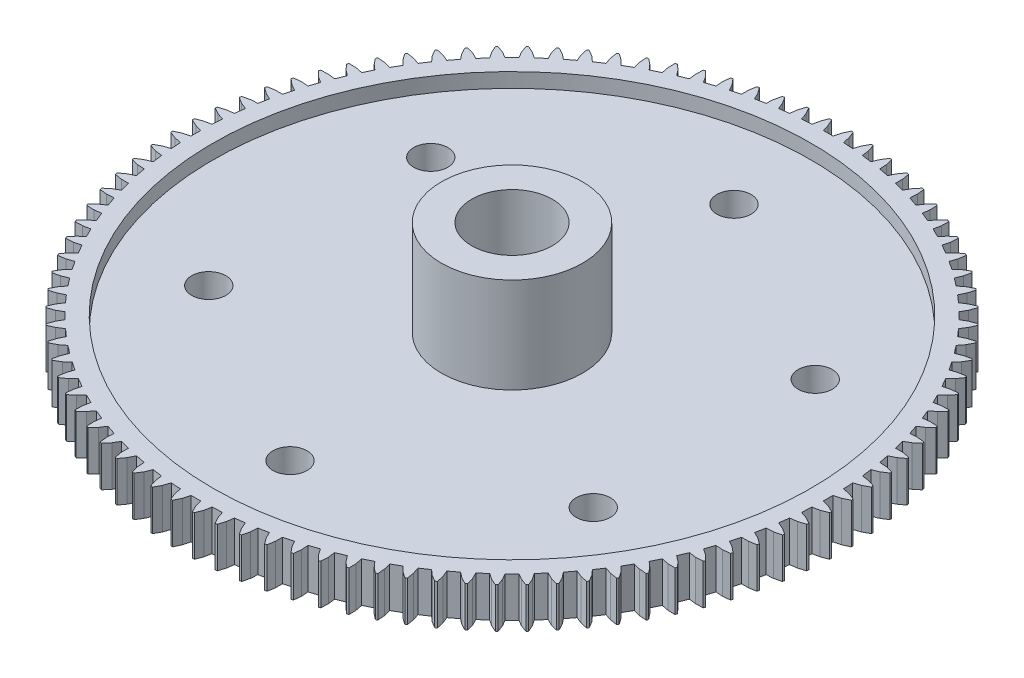
from build123d import *

# Parameters (mm, degrees)
SKETCH1_R           = 25.9334
BOSS_EXTRUDE1_DEPTH = 3.175
SKETCH2_R           = 5.5499
BOSS_EXTRUDE2_DEPTH = 6.35
SKETCH3_R           = 3.175
CUT_EXTRUDE1_DEPTH  = 38.892058484
CUT_EXTRUDE2_START  = -1.143
SKETCH4_R           = 23.5204
SKETCH4_R_2         = 5.5499
CUT_EXTRUDE2_DEPTH  = 1.143
SKETCH5_R           = 1.3462
CUT_EXTRUDE3_DEPTH  = 38.221028614
CIRPATTERN1_COUNT   = 6
CUT_EXTRUDE4_DEPTH  = 38.221028614
CIRPATTERN2_COUNT   = 96


with BuildPart() as part:
    # Sketch1 → Boss-Extrude1 (new body)
    with BuildSketch(Plane(origin=(0, 0, 0), x_dir=(1, 0, 0), z_dir=(0, 1, 0))):
        Circle(SKETCH1_R)
    extrude(amount=BOSS_EXTRUDE1_DEPTH)

    # Sketch2 → Boss-Extrude2 (add)
    with BuildSketch(Plane(origin=(0, 3.175, 0), x_dir=(1, 0, 0), z_dir=(0, 1, 0))):
        Circle(SKETCH2_R)
    extrude(amount=BOSS_EXTRUDE2_DEPTH)

    # Sketch3 → Cut-Extrude1 (cut, through all)
    with BuildSketch(Plane(origin=(0, 9.525, 0), x_dir=(1, 0, 0), z_dir=(0, 1, 0))):
        Circle(SKETCH3_R)
    extrude(amount=-CUT_EXTRUDE1_DEPTH, mode=Mode.SUBTRACT)

    # Sketch4 → Cut-Extrude2 (cut)
    with BuildSketch(Plane(origin=(0, 3.175, 0), x_dir=(1, 0, 0), z_dir=(0, 1, 0)).offset(CUT_EXTRUDE2_START)):
        Circle(SKETCH4_R)
        Circle(SKETCH4_R_2, mode=Mode.SUBTRACT)
    extrude(amount=CUT_EXTRUDE2_DEPTH, mode=Mode.SUBTRACT)

    # Sketch5 → Cut-Extrude3 (cut, through all)
    with BuildSketch(Plane(origin=(0, 3.175, 0), x_dir=(1, 0, 0), z_dir=(0, 1, 0))):
        with Locations((0, 17.4625)):
            Circle(SKETCH5_R)
    cut_extrude3 = extrude(amount=-CUT_EXTRUDE3_DEPTH, mode=Mode.SUBTRACT)

    # CirPattern1: Cut-Extrude3 ×6 about axis
    cirpattern1_axis = Axis((0, 3.175, 0), (0, -1, 0))
    for i in range(1, CIRPATTERN1_COUNT):
        add(cut_extrude3.rotate(cirpattern1_axis, i * 360 / CIRPATTERN1_COUNT), mode=Mode.SUBTRACT)

    # Sketch6 → Cut-Extrude4 (cut, through all)
    with BuildSketch(Plane(origin=(0, 3.175, 0), x_dir=(1, 0, 0), z_dir=(0, 1, 0))):
        Polygon((-0.529166667, 25.4), (-1.138437672, 26.706585887), (1.138437672, 26.706585887), (0.529166667, 25.4), (0.386242567, 24.8666), (-0.386242567, 24.8666), align=None)
    cut_extrude4 = extrude(amount=-CUT_EXTRUDE4_DEPTH, mode=Mode.SUBTRACT)

    # CirPattern2: Cut-Extrude4 ×96 about axis
    cirpattern2_axis = Axis((0, 3.175, 0), (0, -1, 0))
    for i in range(1, CIRPATTERN2_COUNT):
        add(cut_extrude4.rotate(cirpattern2_axis, i * 360 / CIRPATTERN2_COUNT), mode=Mode.SUBTRACT)


solid = part.part
